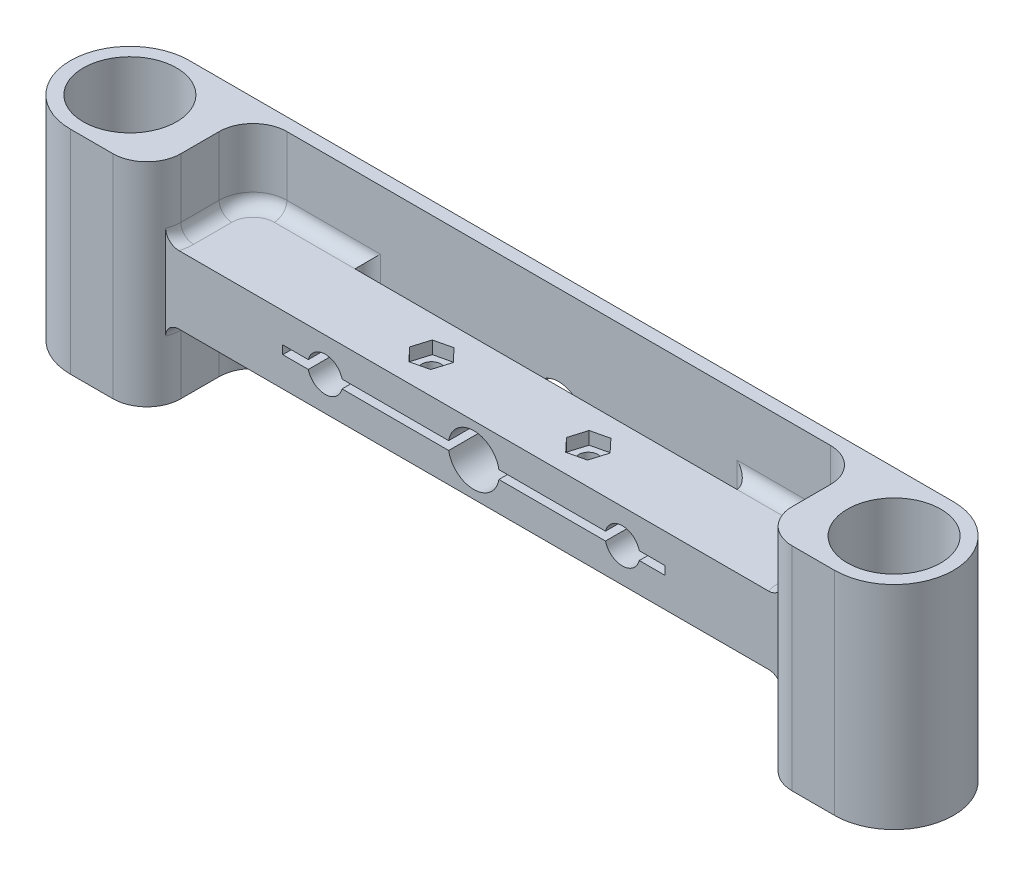
from build123d import *

# Parameters (mm, degrees)
SKETCH1_R                    = 11
BOSS_EXTRUDE1_DEPTH          = 100
FILLET1_R                    = 8
SKETCH2_R                    = 4.1
SKETCH2_R_2                  = 6
CUT_EXTRUDE1_DEPTH           = 10
BOSS_EXTRUDE2_START          = 20
SKETCH3_R                    = 4.1
SKETCH3_R_2                  = 6
BOSS_EXTRUDE2_DEPTH          = 20
FILLET2_R                    = 3
CUT_EXTRUDE_THIN1_DEPTH      = 183.94618817
CUT_EXTRUDE_THIN1_DEPTH_BACK = 20
CUT_EXTRUDE_THIN2_DEPTH      = 163.832913644
CUT_EXTRUDE_THIN2_DEPTH_BACK = 20
FILLET3_R                    = 3
CUT_EXTRUDE2_DEPTH           = 161.472919104
CUT_EXTRUDE2_DEPTH_BACK      = 161.472919104
SKETCH6_R                    = 2.25
CUT_EXTRUDE3_DEPTH           = 3
CUT_EXTRUDE4_DEPTH           = 25
CUT_EXTRUDE5_START           = 25
CUT_EXTRUDE5_DEPTH           = 25


with BuildPart() as part:
    # Sketch1 → Boss-Extrude1 (new body)
    with BuildSketch(Plane(origin=(0, 0, 0), x_dir=(1, 0, 0), z_dir=(0, 1, 0))):
        with BuildLine():
            Line((137.460581558, -14.5), (119.460581558, -14.5))
            Line((119.460581558, -14.5), (119.460581558, 10.5))
            Line((119.460581558, 10.5), (-24.539418442, 10.5))
            Line((-24.539418442, 10.5), (-24.539418442, -14.5))
            Line((-24.539418442, -14.5), (-42.539418442, -14.5))
            ThreePointArc((-42.539418442, -14.5), (-56.539418442, -0.5), (-42.539418442, 13.5))
            Line((-42.539418442, 13.5), (137.460581558, 13.5))
            ThreePointArc((137.460581558, 13.5), (151.460581558, -0.5), (137.460581558, -14.5))
        make_face()
        with Locations(Location((-42.539418442, -0.5, 0), (0, 0, 270))):
            Circle(SKETCH1_R, mode=Mode.SUBTRACT)
        with Locations(Location((137.460581558, -0.5, 0), (0, 0, 270))):
            Circle(SKETCH1_R, mode=Mode.SUBTRACT)
    extrude(amount=BOSS_EXTRUDE1_DEPTH)

    # Fillet1
    fillet1_edges = [part.edges().sort_by_distance(p)[0] for p in [
        (119.460581558, 50, 14.5),
        (119.460581558, 50, -10.5),
        (-24.539418442, 50, -10.5),
        (-24.539418442, 50, 14.5),
    ]]
    fillet(fillet1_edges, radius=FILLET1_R)

    # Sketch2 → Cut-Extrude1 (cut)
    with BuildSketch(Plane.XY.offset(-10.5)):
        with Locations((12.460581558, 50)):
            Circle(SKETCH2_R)
        with Locations((82.460581558, 50)):
            Circle(SKETCH2_R)
        with Locations((47.460581558, 50)):
            Circle(SKETCH2_R_2)
    extrude(amount=-CUT_EXTRUDE1_DEPTH, mode=Mode.SUBTRACT)

    # Sketch3 → Boss-Extrude2 (add)
    with BuildSketch(Plane.XY.offset(-10.5).offset(BOSS_EXTRUDE2_START)):
        Polygon((12.460581558, 58), (82.460581558, 58), (124.149440998, 58), (124.149440998, 42), (82.460581558, 42), (12.460581558, 42), (-28.8662965, 42), (-28.8662965, 58), (-16.539418442, 58), align=None)
        with Locations((12.460581558, 50)):
            Circle(SKETCH3_R, mode=Mode.SUBTRACT)
        with Locations((82.460581558, 50)):
            Circle(SKETCH3_R, mode=Mode.SUBTRACT)
        with Locations((47.460581558, 50)):
            Circle(SKETCH3_R_2, mode=Mode.SUBTRACT)
    extrude(amount=-BOSS_EXTRUDE2_DEPTH)

    # Fillet2
    fillet2_edges = [part.edges().sort_by_distance(p)[0] for p in [
        (-24.686725022, 58, 8.0281381),
        (-24.686725022, 42, 8.0281381),
        (47.460581558, 42, -10.5),
        (117.117435807, 42, -8.156854249),
        (119.460581558, 42, 2),
        (-24.539418442, 42, 2),
        (-22.196272692, 42, -8.156854249),
        (119.607888138, 42, 8.0281381),
        (119.460581558, 58, 2),
        (117.117435807, 58, -8.156854249),
        (47.460581558, 58, -10.5),
        (-22.196272692, 58, -8.156854249),
        (-24.539418442, 58, 2),
        (119.607888138, 58, 8.0281381),
    ]]
    fillet(fillet2_edges, radius=FILLET2_R)

    # Sketch4 → Cut-Extrude-Thin1 (cut, two sides: drawn at the far end of the back side and taken through both)
    with BuildSketch(Plane.XY.offset(9.5).offset(-CUT_EXTRUDE_THIN1_DEPTH_BACK)):
        Polygon((92.460581558, 51), (47.460581558, 51), (2.460581558, 51), (2.460581558, 49), (47.460581558, 49), (92.460581558, 49), align=None)
    extrude(amount=CUT_EXTRUDE_THIN1_DEPTH + CUT_EXTRUDE_THIN1_DEPTH_BACK, mode=Mode.SUBTRACT)

    # Sketch5 → Cut-Extrude-Thin2 (cut, two sides: drawn at the far end of the back side and taken through both)
    with BuildSketch(Plane(origin=(0, 42, 0), x_dir=(-1, 0, 0), z_dir=(0, -1, 0)).offset(-CUT_EXTRUDE_THIN2_DEPTH_BACK)):
        Polygon((-2.460581558, 7.5), (-47.460581558, 7.5), (-92.460581558, 7.5), (-92.460581558, 10.5), (-47.460581558, 10.5), (-2.460581558, 10.5), align=None)
    extrude(amount=CUT_EXTRUDE_THIN2_DEPTH + CUT_EXTRUDE_THIN2_DEPTH_BACK, mode=Mode.SUBTRACT)

    # Fillet3
    fillet3_edges = [part.edges().sort_by_distance(p)[0] for p in [
        (92.460581558, 50, -10.5),
        (2.460581558, 50, -10.5),
    ]]
    fillet(fillet3_edges, radius=FILLET3_R - 0.0001)  # a hair under: the kernel refuses the full size

    # Sketch6 → Cut-Extrude2 (cut, two sides: drawn at the far end of the back side and taken through both)
    with BuildSketch(Plane(origin=(0, 49, 0), x_dir=(1, 0, 0), z_dir=(0, 1, 0)).offset(-CUT_EXTRUDE2_DEPTH_BACK)):
        with Locations(Location((28.990631201, -1, 0), (0, 0, 270))):
            Circle(SKETCH6_R)
        with Locations(Location((65.930531914, -1, 0), (0, 0, 270))):
            Circle(SKETCH6_R)
    extrude(amount=CUT_EXTRUDE2_DEPTH + CUT_EXTRUDE2_DEPTH_BACK, mode=Mode.SUBTRACT)

    # Sketch7 → Cut-Extrude3 (cut)
    with BuildSketch(Plane(origin=(0, 58, 0), x_dir=(1, 0, 0), z_dir=(0, 1, 0))):
        Polygon((33.150591825, -0.026315789), (30.227376252, 3.089473684), (26.067415628, 2.115789474), (24.830670578, -1.973684211), (27.753886151, -5.089473684), (31.913846775, -4.115789474), align=None)
        Polygon((70.090492538, -0.026315789), (67.167276964, 3.089473684), (63.007316341, 2.115789474), (61.77057129, -1.973684211), (64.693786864, -5.089473684), (68.853747488, -4.115789474), align=None)
    extrude(amount=-CUT_EXTRUDE3_DEPTH, mode=Mode.SUBTRACT)

    # Sketch8 → Cut-Extrude4 (cut)
    with BuildSketch(Plane(origin=(0, 100, 0), x_dir=(1, 0, 0), z_dir=(0, 1, 0))):
        with BuildLine():
            Line((119.460581558, 2.5), (119.460581558, -6.5))
            ThreePointArc((119.460581558, -6.5), (121.803727308, -12.156854249), (127.460581558, -14.5))
            Line((127.460581558, -14.5), (137.460581558, -14.5))
            ThreePointArc((137.460581558, -14.5), (151.460581558, -0.5), (137.460581558, 13.5))
            Line((137.460581558, 13.5), (-42.539418442, 13.5))
            ThreePointArc((-42.539418442, 13.5), (-56.539418442, -0.5), (-42.539418442, -14.5))
            Line((-42.539418442, -14.5), (-32.539418442, -14.5))
            ThreePointArc((-32.539418442, -14.5), (-26.882564193, -12.156854249), (-24.539418442, -6.5))
            Line((-24.539418442, -6.5), (-24.539418442, 2.5))
            ThreePointArc((-24.539418442, 2.5), (-22.196272692, 8.156854249), (-16.539418442, 10.5))
            Line((-16.539418442, 10.5), (111.460581558, 10.5))
            ThreePointArc((111.460581558, 10.5), (117.117435807, 8.156854249), (119.460581558, 2.5))
        make_face()
    extrude(amount=-CUT_EXTRUDE4_DEPTH, mode=Mode.SUBTRACT)

    # Sketch9 → Cut-Extrude5 (cut)
    with BuildSketch(Plane(origin=(0, 0, 0), x_dir=(1, 0, 0), z_dir=(0, 1, 0)).offset(CUT_EXTRUDE5_START)):
        with BuildLine():
            Line((127.460581558, -14.5), (137.460581558, -14.5))
            ThreePointArc((137.460581558, -14.5), (151.460581558, -0.5), (137.460581558, 13.5))
            Line((137.460581558, 13.5), (-42.539418442, 13.5))
            ThreePointArc((-42.539418442, 13.5), (-56.539418442, -0.5), (-42.539418442, -14.5))
            Line((-42.539418442, -14.5), (-32.539418442, -14.5))
            ThreePointArc((-32.539418442, -14.5), (-26.882564193, -12.156854249), (-24.539418442, -6.5))
            Line((-24.539418442, -6.5), (-24.539418442, 2.5))
            ThreePointArc((-24.539418442, 2.5), (-22.196272692, 8.156854249), (-16.539418442, 10.5))
            Line((-16.539418442, 10.5), (111.460581558, 10.5))
            ThreePointArc((111.460581558, 10.5), (117.117435807, 8.156854249), (119.460581558, 2.5))
            Line((119.460581558, 2.5), (119.460581558, -6.5))
            ThreePointArc((119.460581558, -6.5), (121.803727308, -12.156854249), (127.460581558, -14.5))
        make_face()
    extrude(amount=-CUT_EXTRUDE5_DEPTH, mode=Mode.SUBTRACT)


solid = part.part
